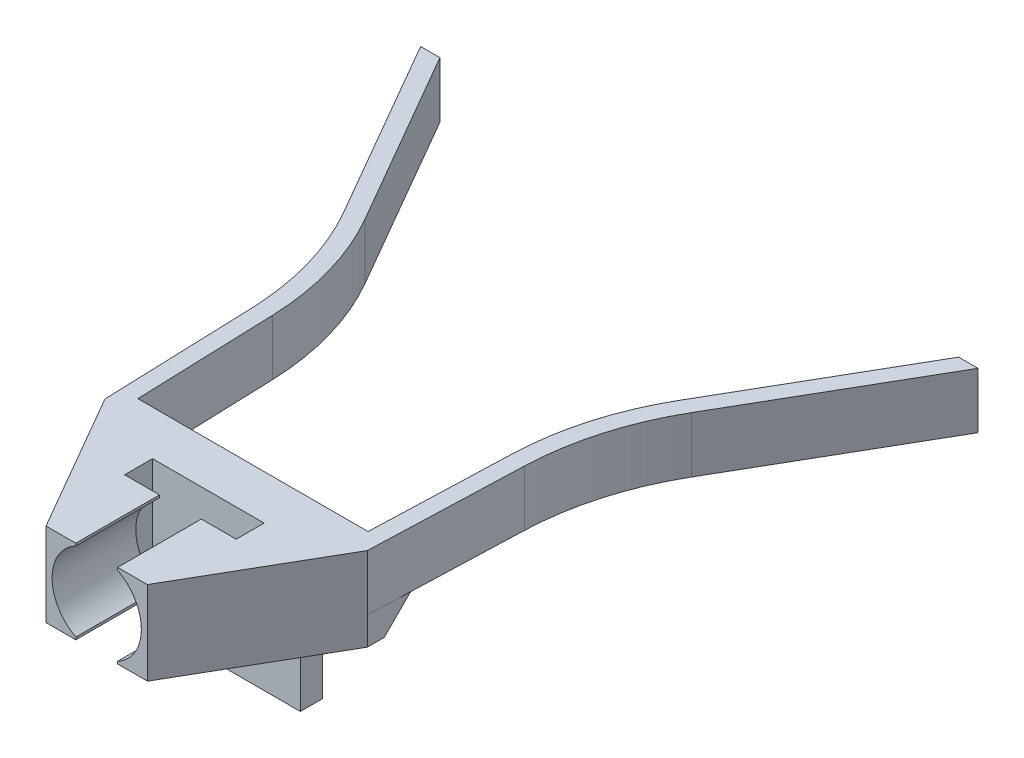
from build123d import *
from OCP.BRepFilletAPI import BRepFilletAPI_MakeChamfer

# Parameters (mm, degrees)
BOSS_EXTRUDE1_DEPTH             = 2
BOSS_EXTRUDE2_REACH             = 40.8
SKETCH2_W                       = 18.81765306
SKETCH2_H                       = 6
BOSS_EXTRUDE2_DIRECTION_2_DEPTH = 10
CUT_EXTRUDE1_DEPTH              = 8
CUT_EXTRUDE2_DEPTH              = 38.936459462
CUT_EXTRUDE2_DEPTH_BACK         = 38.936459462
SKETCH4_W                       = 8
SKETCH4_H                       = 2
CHAMFER1_SIZE                   = 2
CHAMFER2_SIZE                   = 10
CHAMFER2_SIZE2                  = 5.773502692
FILLET1_R                       = 20
BOSS_EXTRUDE3_START             = -6
SKETCH5_W                       = 10
SKETCH5_H                       = 1.6
BOSS_EXTRUDE3_DEPTH             = 12


with BuildPart() as part:
    # Sketch1 → Boss-Extrude1 (new, symmetric)
    with BuildSketch(Plane(origin=(0, 0, 0), x_dir=(1, 0, 0), z_dir=(0, 1, 0))):
        Polygon((-8.25, 0), (0, 0), (0, -1.2), (-9.40882653, -1.2), (-9.962319737, 14.649971666), (-19.979363266, 32), (-18.59372262, 32), (-8.773492451, 14.990862405), align=None)
    boss_extrude1 = extrude(amount=BOSS_EXTRUDE1_DEPTH, both=True)

    # Mirror1: Boss-Extrude1 across plane
    add(boss_extrude1.mirror(Plane(origin=(0, 2, 0), x_dir=(0, 0, 1), z_dir=(-1, 0, 0))))

    # Boss-Extrude2: up to this face of the body (flat: up to its plane)
    boss_extrude2_end = Plane(part.part.faces().sort_by_distance((0, 0, 0))[0])
    # Sketch2 → Boss-Extrude2 (add, up to the picked face)
    with BuildSketch(Plane.XY.offset(1.2), mode=Mode.PRIVATE) as boss_extrude2_sk1:
        with Locations((0, -1)):
            Rectangle(SKETCH2_W, SKETCH2_H)
    boss_extrude2_tool1 = split(extrude(boss_extrude2_sk1.sketch, amount=-BOSS_EXTRUDE2_REACH, mode=Mode.PRIVATE), bisect_by=boss_extrude2_end, keep=Keep.BOTH, mode=Mode.PRIVATE)
    add(boss_extrude2_tool1.solids().sort_by(Axis((0, -1, 1.2), (0, 0, -1)))[0])

    # Sketch2 → Boss-Extrude2 direction 2 (add)
    with BuildSketch(Plane.XY.offset(1.2)):
        with Locations((0, -1)):
            Rectangle(SKETCH2_W, SKETCH2_H)
    extrude(amount=BOSS_EXTRUDE2_DIRECTION_2_DEPTH)

    # Sketch3 → Cut-Extrude1 (cut)
    with BuildSketch(Plane.XY.offset(11.2)):
        with BuildLine():
            Line((-1.5, 1.826658805), (-1.5, 2))
            Line((-1.5, 2), (1.5, 2))
            Line((1.5, 2), (1.5, 1.826658805))
            ThreePointArc((1.5, 1.826658805), (3.2, -1), (1.5, -3.826658805))
            Line((1.5, -3.826658805), (1.5, -4))
            Line((1.5, -4), (-1.5, -4))
            Line((-1.5, -4), (-1.5, -3.826658805))
            ThreePointArc((-1.5, -3.826658805), (-3.2, -1), (-1.5, 1.826658805))
        make_face()
    extrude(amount=-CUT_EXTRUDE1_DEPTH, mode=Mode.SUBTRACT)

    # Sketch4 → Cut-Extrude2 (cut, two sides: drawn at the far end of the back side and taken through both)
    with BuildSketch(Plane(origin=(0, 0, 0), x_dir=(1, 0, 0), z_dir=(0, 1, 0)).offset(-CUT_EXTRUDE2_DEPTH_BACK)):
        with Locations((0, -4.2)):
            Rectangle(SKETCH4_W, SKETCH4_H)
    extrude(amount=CUT_EXTRUDE2_DEPTH + CUT_EXTRUDE2_DEPTH_BACK, mode=Mode.SUBTRACT)

    # Chamfer1
    chamfer1_edges = [part.edges().sort_by_distance(p)[0] for p in [
        (8.829413265, -2, 0),
        (-8.829413265, -2, 0),
    ]]
    chamfer(chamfer1_edges, length=CHAMFER1_SIZE - 0.0001)  # a hair under: the kernel refuses the full size

    # Chamfer2: one chamfer whose edges measure the first distance from different faces: ONE call of the kernel's chamfer builder (chamfer() names one face for all edges)
    chamfer2_edges_1 = [part.edges().sort_by_distance(p)[0] for p in [
        (9.40882653, -1, 11.2),
    ]]
    chamfer2_side_1 = [part.faces().sort_by_distance(p)[0] for p in [
        (9.40882653, -1.126288177, 5.77807488),
    ]]
    chamfer2_edges_2 = [part.edges().sort_by_distance(p)[0] for p in [
        (-9.40882653, -1, 11.2),
    ]]
    chamfer2_side_2 = [part.faces().sort_by_distance(p)[0] for p in [
        (-9.40882653, -1.126288177, 5.77807488),
    ]]
    chamfer2 = BRepFilletAPI_MakeChamfer(part.part.solid().wrapped)
    for e in chamfer2_edges_1:
        chamfer2.Add(CHAMFER2_SIZE, CHAMFER2_SIZE2, e.wrapped, chamfer2_side_1[0].wrapped)  # the first distance lies on this face
    for e in chamfer2_edges_2:
        chamfer2.Add(CHAMFER2_SIZE, CHAMFER2_SIZE2, e.wrapped, chamfer2_side_2[0].wrapped)  # the first distance lies on this face
    add(Compound.cast(chamfer2.Shape()), mode=Mode.REPLACE)

    # Fillet1
    fillet1_edges = [part.edges().sort_by_distance(p)[0] for p in [
        (-9.962319737, 0, -14.649971666),
        (-8.773492451, 0, -14.990862405),
        (8.773492451, 0, -14.990862405),
        (9.962319737, 0, -14.649971666),
    ]]
    fillet(fillet1_edges, radius=FILLET1_R)

    # Sketch5 → Boss-Extrude3 (add)
    with BuildSketch(Plane.XZ.offset(4).offset(BOSS_EXTRUDE3_START)):
        with Locations((0, 0.8)):
            Rectangle(SKETCH5_W, SKETCH5_H)
    extrude(amount=BOSS_EXTRUDE3_DEPTH)


solid = part.part
